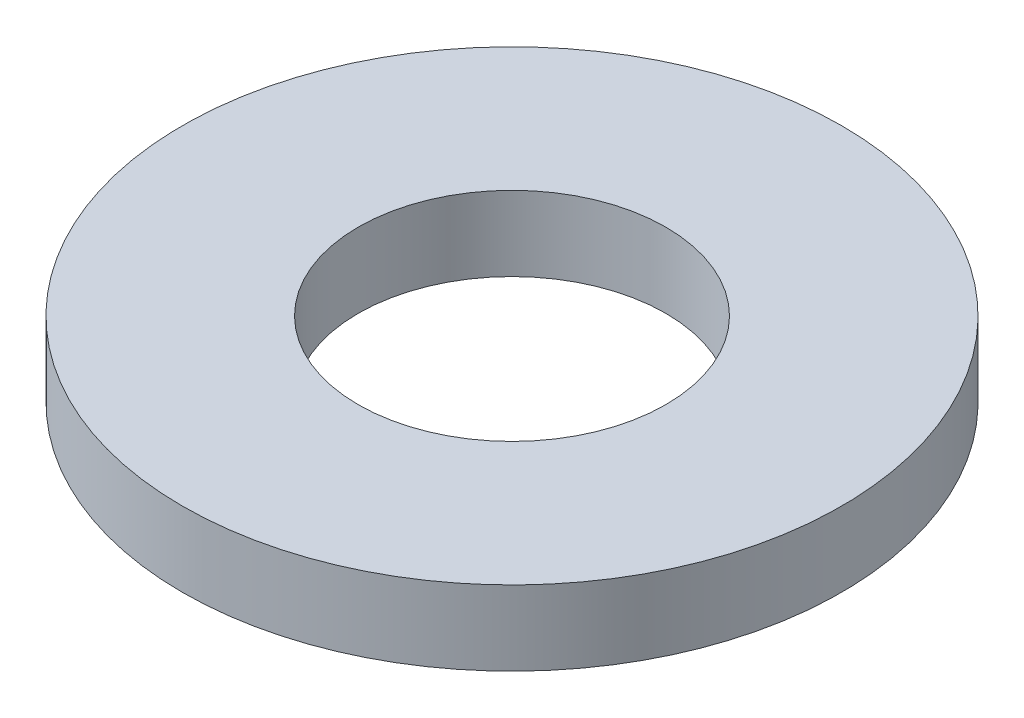
from build123d import *

# Parameters (mm, degrees)
SKETCH1_R           = 75
BOSS_EXTRUDE1_DEPTH = 17
SKETCH2_R           = 35
CUT_EXTRUDE1_DEPTH  = 108.419737479


with BuildPart() as part:
    # Sketch1 → Boss-Extrude1 (new body)
    with BuildSketch(Plane(origin=(0, 0, 0), x_dir=(1, 0, 0), z_dir=(0, 1, 0))):
        Circle(SKETCH1_R)
    extrude(amount=BOSS_EXTRUDE1_DEPTH)

    # Sketch2 → Cut-Extrude1 (cut, through all)
    with BuildSketch(Plane(origin=(0, 0, 0), x_dir=(1, 0, 0), z_dir=(0, 1, 0))):
        Circle(SKETCH2_R)
    extrude(amount=CUT_EXTRUDE1_DEPTH, mode=Mode.SUBTRACT)


solid = part.part
